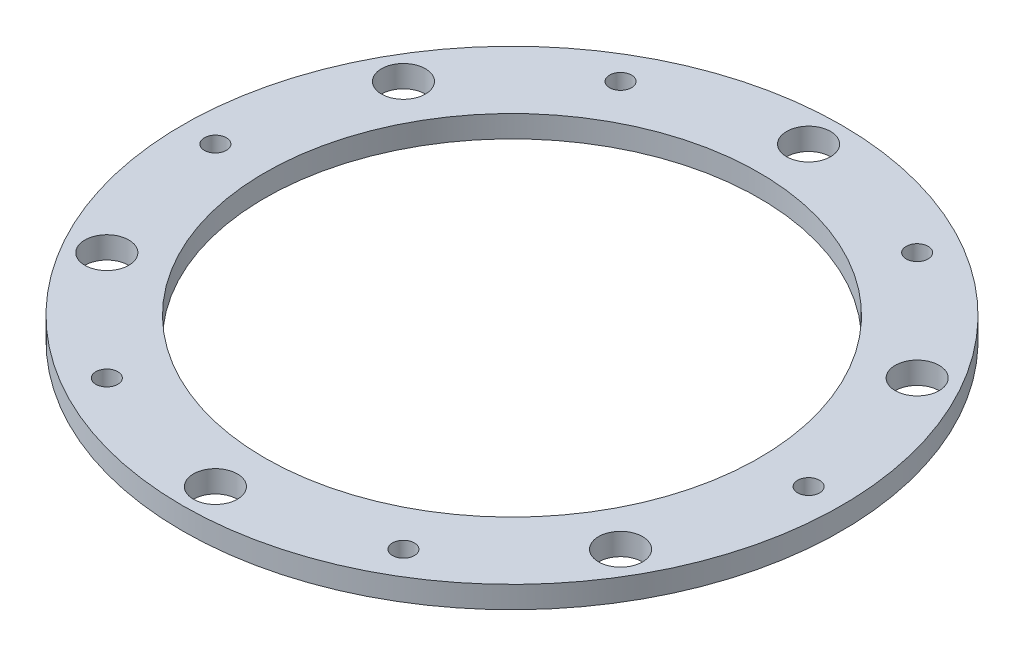
from build123d import *

# Parameters (mm, degrees)
SKETCH1_R           = 30
SKETCH1_R_2         = 2
SKETCH1_R_3         = 22.5
BOSS_EXTRUDE1_DEPTH = 2
SKETCH3_R           = 1
CUT_EXTRUDE1_DEPTH  = 3


with BuildPart() as part:
    # Sketch1 → Boss-Extrude1 (new body)
    with BuildSketch(Plane(origin=(0, 0, 0), x_dir=(1, 0, 0), z_dir=(0, 1, 0))):
        Circle(SKETCH1_R)
        with Locations((0, 27)):
            Circle(SKETCH1_R_2, mode=Mode.SUBTRACT)
        with Locations((23.382685902, 13.5)):
            Circle(SKETCH1_R_2, mode=Mode.SUBTRACT)
        with Locations((23.382685902, -13.5)):
            Circle(SKETCH1_R_2, mode=Mode.SUBTRACT)
        with Locations((0, -27)):
            Circle(SKETCH1_R_2, mode=Mode.SUBTRACT)
        with Locations((-23.382685902, -13.5)):
            Circle(SKETCH1_R_2, mode=Mode.SUBTRACT)
        with Locations((-23.382685902, 13.5)):
            Circle(SKETCH1_R_2, mode=Mode.SUBTRACT)
        Circle(SKETCH1_R_3, mode=Mode.SUBTRACT)
    extrude(amount=BOSS_EXTRUDE1_DEPTH)

    # Sketch3 → Cut-Extrude1 (cut)
    with BuildSketch(Plane(origin=(0, 2, 0), x_dir=(1, 0, 0), z_dir=(0, 1, 0))):
        with Locations((-13.5, 23.382685902)):
            Circle(SKETCH3_R)
        with Locations((13.5, 23.382685902)):
            Circle(SKETCH3_R)
        with Locations((27, 0)):
            Circle(SKETCH3_R)
        with Locations((13.5, -23.382685902)):
            Circle(SKETCH3_R)
        with Locations((-13.5, -23.382685902)):
            Circle(SKETCH3_R)
        with Locations((-27, 0)):
            Circle(SKETCH3_R)
    extrude(amount=-CUT_EXTRUDE1_DEPTH, mode=Mode.SUBTRACT)


solid = part.part
